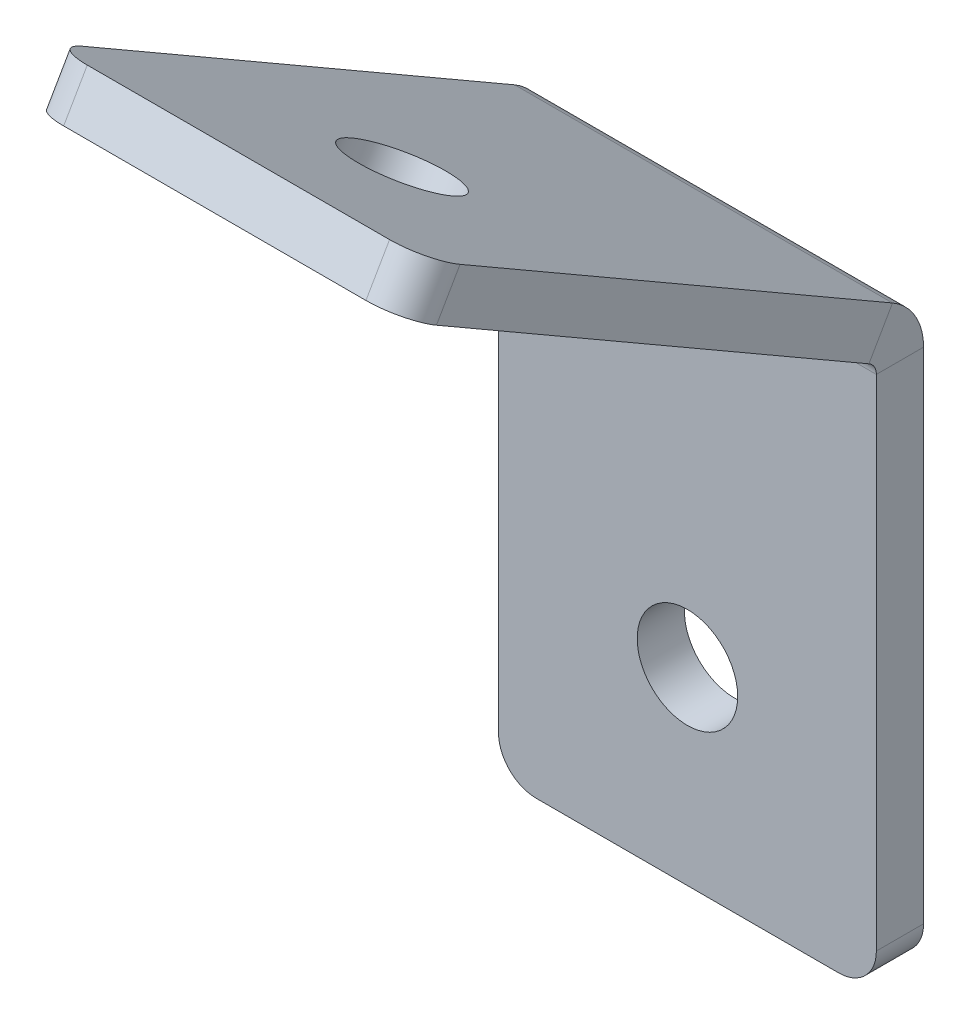
from build123d import *

# Parameters (mm, degrees)
SKETCH1_R                  = 3.3782
BASE_FLANGE1_DEPTH         = 3.175
SKETCHED_START             = -12.7
SKETCHED_BEND1_DEPTH       = 25.4
SKETCHED_START_2           = -10.229596
SKETCHED_BEND1_2_DEPTH     = 6.8513959
SKETCHED_START_3           = 3.3782001
SKETCHED_BEND1_3_DEPTH     = 6.7817999
SKETCHED_BEND1_4_DEPTH     = 25.4
SKETCHED_START_4           = 9.775295033
SKETCHED_BEND1_5_OUTLINE_R = 3.3782
SKETCHED_BEND1_5_DEPTH     = 3.175


with BuildPart() as part:
    # Base-Flange1: sheet metal written as solids
    # Sketch1 → Base-Flange1 (new body)
    with BuildSketch(Plane.XY):
        with BuildLine():
            Line((-10.16, -25.4), (10.16, -25.4))
            ThreePointArc((10.16, -25.4), (11.956051224, -24.656051224), (12.7, -22.86))
            Line((12.7, -22.86), (12.7, 46.99))
            ThreePointArc((12.7, 46.99), (11.956051224, 48.786051224), (10.16, 49.53))
            Line((10.16, 49.53), (-10.16, 49.53))
            ThreePointArc((-10.16, 49.53), (-11.956051224, 48.786051224), (-12.7, 46.99))
            Line((-12.7, 46.99), (-12.7, -22.86))
            ThreePointArc((-12.7, -22.86), (-11.956051224, -24.656051224), (-10.16, -25.4))
        make_face()
        with Locations((0, 36.83)):
            Circle(SKETCH1_R, mode=Mode.SUBTRACT)
        with Locations((0, -12.7)):
            Circle(SKETCH1_R, mode=Mode.SUBTRACT)
    extrude(amount=-BASE_FLANGE1_DEPTH)

    # Sketched Bend1: read off the stored shape, not the designer's step
    # Sketched Bend1 outline → Sketched Bend1 (cut)
    with BuildSketch(Plane.YZ.offset(SKETCHED_START)):
        with BuildLine():
            Line((49.53, 0), (14.953712647, 0))
            Line((14.953712647, 0), (14.325844229, -1.0875))
            ThreePointArc((14.325844229, -1.0875), (12.797688168, -2.615656061), (10.710188168, -3.175))
            Line((10.710188168, -3.175), (49.53, -3.175))
            Line((49.53, -3.175), (49.53, 0))
        make_face()
    extrude(amount=SKETCHED_BEND1_DEPTH, mode=Mode.SUBTRACT)

    # Sketched Bend1 2 outline → Sketched Bend1 2 (add)
    with BuildSketch(Plane.YZ.offset(SKETCHED_START_2)):
        with BuildLine():
            Line((29.631307656, 31.772340289), (11.576213572, 0.5))
            ThreePointArc((11.576213572, 0.5), (11.210188168, 0.133974596), (10.710188168, 0))
            Line((10.710188168, 0), (14.953712647, 0))
            Line((14.953712647, 0), (32.380938313, 30.184840289))
            Line((32.380938313, 30.184840289), (29.631307656, 31.772340289))
        make_face()
    extrude(amount=SKETCHED_BEND1_2_DEPTH)

    # Sketched Bend1 3 outline → Sketched Bend1 3 (add)
    with BuildSketch(Plane.YZ.offset(SKETCHED_START_3)):
        with BuildLine():
            Line((29.631307656, 31.772340289), (11.576213572, 0.5))
            ThreePointArc((11.576213572, 0.5), (11.210188168, 0.133974596), (10.710188168, 0))
            Line((10.710188168, 0), (14.953712647, 0))
            Line((14.953712647, 0), (32.380938313, 30.184840289))
            Line((32.380938313, 30.184840289), (29.631307656, 31.772340289))
        make_face()
    extrude(amount=SKETCHED_BEND1_3_DEPTH)

    # Sketched Bend1 4 outline → Sketched Bend1 4 (add)
    with BuildSketch(Plane.YZ.offset(SKETCHED_START)):
        with BuildLine():
            Line((29.631307656, 31.772340289), (11.576213572, 0.5))
            ThreePointArc((11.576213572, 0.5), (11.210188168, 0.133974596), (10.710188168, 0))
            Line((10.710188168, 0), (14.953712647, 0))
            Line((14.953712647, 0), (32.380938313, 30.184840289))
            Line((32.380938313, 30.184840289), (29.631307656, 31.772340289))
        make_face()
    extrude(amount=SKETCHED_BEND1_4_DEPTH)

    # Sketched Bend1 5 outline → Sketched Bend1 5 (cut)
    with BuildSketch(Plane(origin=(0, 0, 0), x_dir=(1, 0, 0), z_dir=(0, 0.8660254037844399, -0.49999999999999795)).offset(SKETCHED_START_4)):
        with BuildLine():
            Line((-12.7, -42.331307656), (-10.16, -42.331307656))
            ThreePointArc((-10.16, -42.331307656), (-11.956051224, -41.58735888), (-12.7, -39.791307656))
            Line((-12.7, -39.791307656), (-12.7, -42.331307656))
        make_face()
        with BuildLine():
            ThreePointArc((12.7, -39.791307656), (11.956051224, -41.58735888), (10.16, -42.331307656))
            Line((10.16, -42.331307656), (12.7, -42.331307656))
            Line((12.7, -42.331307656), (12.7, -39.791307656))
        make_face()
        with Locations((0, -29.631307656)):
            Circle(SKETCHED_BEND1_5_OUTLINE_R)
    extrude(amount=SKETCHED_BEND1_5_DEPTH, mode=Mode.SUBTRACT)


solid = part.part
